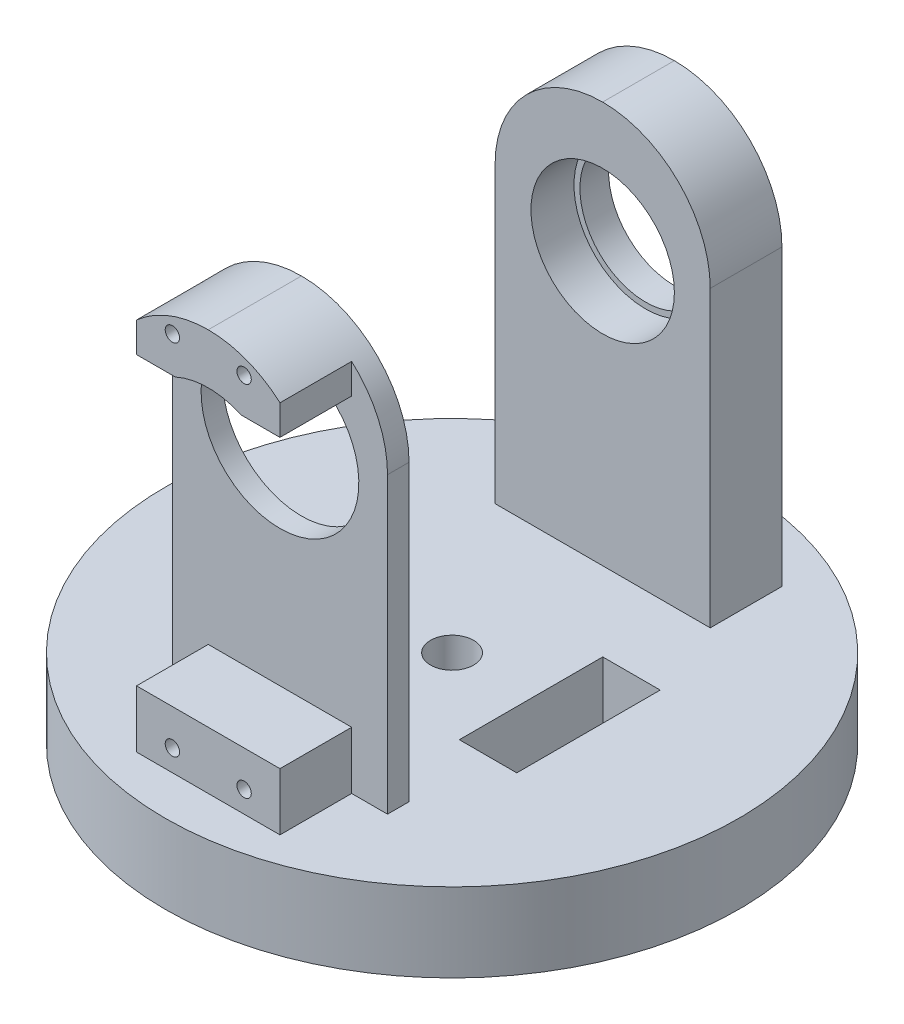
from build123d import *

# Parameters (mm, degrees)
SKETCH1_R               = 40
BOSS_EXTRUDE1_DEPTH     = 11
SKETCH3_W               = 10
SKETCH3_H               = 7
SKETCH5_R               = 3
CUT_EXTRUDE2_DEPTH      = 6
SKETCH6_W               = 30
SKETCH6_H               = 3
BOSS_EXTRUDE2_DEPTH     = 56
SKETCH7_W               = 20
SKETCH7_H               = 8
BOSS_EXTRUDE3_DEPTH     = 10
CUT_EXTRUDE4_DEPTH      = 101.920760996
CUT_EXTRUDE4_DEPTH_BACK = 5
SKETCH9_R               = 11
FILLET2_R               = 15
SKETCH13_R              = 10
BOSS_EXTRUDE4_DEPTH     = 0.5
SKETCH14_R              = 1
BOSS_EXTRUDE5_DEPTH     = 2
SKETCH4_R               = 1.5
CUT_EXTRUDE1_DEPTH      = 80.598994969
SKETCH15_W              = 30
SKETCH15_H              = 10
BOSS_EXTRUDE6_DEPTH     = 56
FILLET3_R               = 15
SKETCH16_R              = 1
CUT_EXTRUDE5_DEPTH      = 5
SKETCH20_R              = 10
CUT_EXTRUDE8_DEPTH      = 6
SKETCH22_R              = 9.171602893
CUT_EXTRUDE9_DEPTH      = 6
SKETCH23_W              = 8.009683582
SKETCH23_H              = 20
CUT_EXTRUDE10_DEPTH     = 14


with BuildPart() as part:
    # Sketch1 → Boss-Extrude1 (new body)
    with BuildSketch(Plane(origin=(0, 0, 0), x_dir=(1, 0, 0), z_dir=(0, 1, 0))):
        with Locations(Location((0, 0, 0), (0, 0, 270))):
            Circle(SKETCH1_R)
    extrude(amount=BOSS_EXTRUDE1_DEPTH)

    # Sketch3 → Cut-Revolve1 (revolve, cut)
    with BuildSketch(Plane.XY, mode=Mode.PRIVATE) as cut_revolve1_sk:
        with Locations((-30, 3.5)):
            Rectangle(SKETCH3_W, SKETCH3_H)
    revolve(cut_revolve1_sk.sketch.rotate(Axis((0, 17.41193703, 0), (0, -1, 0)), 270), axis=Axis((0, 17.41193703, 0), (0, -1, 0)), mode=Mode.SUBTRACT)

    # Sketch5 → Cut-Extrude2 (cut)
    with BuildSketch(Plane(origin=(0, 11, 0), x_dir=(1, 0, 0), z_dir=(0, 1, 0))):
        with Locations(Location((0, 0, 0), (0, 0, 270))):
            Circle(SKETCH5_R)
    extrude(amount=-CUT_EXTRUDE2_DEPTH, mode=Mode.SUBTRACT)

    # Sketch6 → Boss-Extrude2 (add)
    with BuildSketch(Plane(origin=(0, 11, 0), x_dir=(1, 0, 0), z_dir=(0, 1, 0))):
        with Locations((0, -22.5)):
            Rectangle(SKETCH6_W, SKETCH6_H)
    extrude(amount=BOSS_EXTRUDE2_DEPTH)

    # Sketch7 → Boss-Extrude3 (add)
    with BuildSketch(Plane.XY.offset(24)):
        with Locations((0, 15)):
            Rectangle(SKETCH7_W, SKETCH7_H)
        with Locations((0, 63)):
            Rectangle(SKETCH7_W, SKETCH7_H)
    extrude(amount=BOSS_EXTRUDE3_DEPTH)

    # Sketch9 → Cut-Extrude4 (cut, two sides: drawn at the far end of the back side and taken through both)
    with BuildSketch(Plane.XY.offset(24).offset(-CUT_EXTRUDE4_DEPTH_BACK)):
        with Locations(Location((0, 49, 0), (0, 0, 114.619977329))):
            Circle(SKETCH9_R)
    extrude(amount=CUT_EXTRUDE4_DEPTH + CUT_EXTRUDE4_DEPTH_BACK, mode=Mode.SUBTRACT)

    # Fillet2
    fillet2_edges = [part.edges().sort_by_distance(p)[0] for p in [
        (15, 67, 22.5),
        (-15, 67, 22.5),
    ]]
    fillet(fillet2_edges, radius=FILLET2_R - 0.0001)  # a hair under: the kernel refuses the full size

    # Sketch13 → Boss-Extrude4 (add)
    with BuildSketch(Plane.XZ):
        with Locations(Location((0, 0, 0), (0, 0, 270))):
            Circle(SKETCH13_R)
    extrude(amount=BOSS_EXTRUDE4_DEPTH)

    # Sketch14 → Boss-Extrude5 (add)
    with BuildSketch(Plane.XZ.offset(0.5)):
        with Locations(Location((0, 7, 0), (0, 0, 270))):
            Circle(SKETCH14_R)
        with Locations(Location((0, -7, 0), (0, 0, 90))):
            Circle(SKETCH14_R)
        with Locations(Location((7.141428429, 0, 0), (0, 0, 270))):
            Circle(SKETCH14_R)
        with Locations(Location((-7.141428429, 0, 0), (0, 0, 90))):
            Circle(SKETCH14_R)
    extrude(amount=BOSS_EXTRUDE5_DEPTH)

    # Sketch4 → Cut-Extrude1 (cut, through all)
    with BuildSketch(Plane(origin=(0, 11, 0), x_dir=(1, 0, 0), z_dir=(0, 1, 0))):
        with Locations(Location((0, 0, 0), (0, 0, 270))):
            Circle(SKETCH4_R)
    extrude(amount=-CUT_EXTRUDE1_DEPTH, mode=Mode.SUBTRACT)

    # Sketch15 → Boss-Extrude6 (add)
    with BuildSketch(Plane(origin=(0, 11, 0), x_dir=(1, 0, 0), z_dir=(0, 1, 0))):
        with Locations((0, 26)):
            Rectangle(SKETCH15_W, SKETCH15_H)
    extrude(amount=BOSS_EXTRUDE6_DEPTH)

    # Fillet3
    fillet3_edges = [part.edges().sort_by_distance(p)[0] for p in [
        (-15, 67, -26),
        (15, 67, -26),
    ]]
    fillet(fillet3_edges, radius=FILLET3_R - 0.0001)  # a hair under: the kernel refuses the full size

    # Sketch16 → Cut-Extrude5 (cut)
    with BuildSketch(Plane.XY.offset(34)):
        with Locations((-5, 64)):
            Circle(SKETCH16_R)
        with Locations(Location((5, 64, 0), (0, 0, 180))):
            Circle(SKETCH16_R)
        with Locations(Location((-5, 14, 0), (0, 0, 180))):
            Circle(SKETCH16_R)
        with Locations((5, 14)):
            Circle(SKETCH16_R)
    extrude(amount=-CUT_EXTRUDE5_DEPTH, mode=Mode.SUBTRACT)

    # Sketch20 → Cut-Extrude8 (cut)
    with BuildSketch(Plane.XY.offset(-21)):
        with Locations((0, 49)):
            Circle(SKETCH20_R)
    extrude(amount=-CUT_EXTRUDE8_DEPTH, mode=Mode.SUBTRACT)

    # Sketch22 → Cut-Extrude9 (cut)
    with BuildSketch(Plane.XY.offset(-27)):
        with Locations((0, 49)):
            Circle(SKETCH22_R)
    extrude(amount=-CUT_EXTRUDE9_DEPTH, mode=Mode.SUBTRACT)

    # Sketch23 → Cut-Extrude10 (cut)
    with BuildSketch(Plane.XZ):
        with Locations((15.018156717, 0)):
            Rectangle(SKETCH23_W, SKETCH23_H)
    extrude(amount=-CUT_EXTRUDE10_DEPTH, mode=Mode.SUBTRACT)


solid = part.part
